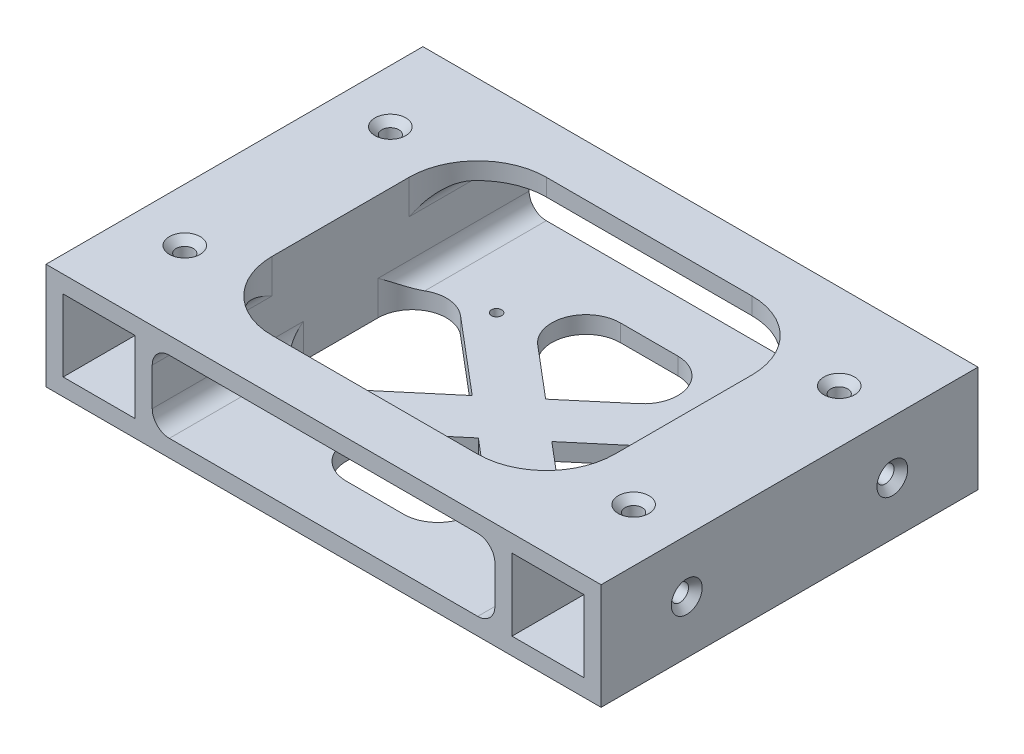
from build123d import *

# Parameters (mm, degrees)
SKETCH1_W           = 162
SKETCH1_H           = 31
SKETCH1_W_2         = 21
SKETCH1_H_2         = 21
SKETCH1_W_3         = 100
BOSS_EXTRUDE1_DEPTH = 55
SKETCH2_R           = 1.5
CUT_EXTRUDE1_DEPTH  = 5
SKETCH3_W           = 100
SKETCH3_H           = 80
CUT_EXTRUDE2_DEPTH  = 5
FILLET1_R           = 10
FILLET3_R           = 5
SKETCH4_R           = 2.5
CUT_EXTRUDE3_DEPTH  = 103.698588195
SKETCH5_R           = 2.5
CUT_EXTRUDE4_DEPTH  = 10
CHAMFER1_SIZE       = 2
FILLET4_START       = -40
FILLET4_DEPTH       = 20.0000001
FILLET4_START_2     = 19.9999999
FILLET4_2_DEPTH     = 20.0000001
FILLET4_START_3     = 4
FILLET4_3_DEPTH     = 11.5


with BuildPart() as part:
    # Sketch1 → Boss-Extrude1 (new, symmetric)
    with BuildSketch(Plane.XY):
        Rectangle(SKETCH1_W, SKETCH1_H)
        with Locations((65.5, 0)):
            Rectangle(SKETCH1_W_2, SKETCH1_H_2, mode=Mode.SUBTRACT)
        with Locations((-65.5, 0)):
            Rectangle(SKETCH1_W_2, SKETCH1_H_2, mode=Mode.SUBTRACT)
        Rectangle(SKETCH1_W_3, SKETCH1_H_2, mode=Mode.SUBTRACT)
    extrude(amount=BOSS_EXTRUDE1_DEPTH, both=True)

    # Sketch2 → Cut-Extrude1 (cut)
    with BuildSketch(Plane.XZ.offset(15.5)):
        with Locations(Location((29, -24.5, 0), (0, 0, 270))):
            Circle(SKETCH2_R)
        with Locations(Location((-29, -24.5, 0), (0, 0, 270))):
            Circle(SKETCH2_R)
        with Locations(Location((29, 24.5, 0), (0, 0, 270))):
            Circle(SKETCH2_R)
        with Locations(Location((-29, 24.5, 0), (0, 0, 270))):
            Circle(SKETCH2_R)
        Polygon((-50, -32.423155549), (-50, 32.423155549), (-11.621570983, 0), align=None)
        Polygon((-35.725367792, 40), (0, 9.818223762), (35.725367792, 40), align=None)
        Polygon((50, 32.423155549), (11.621570983, 0), (50, -32.423155549), align=None)
        Polygon((-35.725367792, -40), (0, -9.818223762), (35.725367792, -40), align=None)
    extrude(amount=-CUT_EXTRUDE1_DEPTH, mode=Mode.SUBTRACT)

    # Sketch3 → Cut-Extrude2 (cut)
    with BuildSketch(Plane(origin=(0, 15.5, 0), x_dir=(1, 0, 0), z_dir=(0, 1, 0))):
        Rectangle(SKETCH3_W, SKETCH3_H)
    extrude(amount=-CUT_EXTRUDE2_DEPTH, mode=Mode.SUBTRACT)

    # Fillet1
    fillet1_edges = [part.edges().sort_by_distance(p)[0] for p in [
        (-35.725367792, -13, -40),
        (35.725367792, -13, -40),
        (35.725367792, -13, 40),
        (-35.725367792, -13, 40),
        (50, -13, -32.423155549),
        (50, -13, 32.423155549),
        (-50, -13, 32.423155549),
        (-50, -13, -32.423155549),
    ]]
    fillet(fillet1_edges, radius=FILLET1_R)

    # Fillet3
    fillet3_edges = [part.edges().sort_by_distance(p)[0] for p in [
        (50, 10.5, -47.5),
        (-50, 10.5, -47.5),
        (-50, 10.5, 47.5),
        (-50, -10.5, 32.941957335),
        (50, -10.5, 32.941957335),
        (50, 10.5, 47.5),
        (50, -10.5, -32.941957335),
        (-50, -10.5, -32.941957335),
    ]]
    fillet(fillet3_edges, radius=FILLET3_R)

    # Sketch4 → Cut-Extrude3 (cut, through all)
    with BuildSketch(Plane(origin=(0, 15.5, 0), x_dir=(1, 0, 0), z_dir=(0, 1, 0))):
        with Locations(Location((65.5, 30, 0), (0, 0, 270))):
            Circle(SKETCH4_R)
        with Locations(Location((65.5, -30, 0), (0, 0, 270))):
            Circle(SKETCH4_R)
        with Locations(Location((-65.5, 30, 0), (0, 0, 270))):
            Circle(SKETCH4_R)
        with Locations(Location((-65.5, -30, 0), (0, 0, 270))):
            Circle(SKETCH4_R)
    extrude(amount=-CUT_EXTRUDE3_DEPTH, mode=Mode.SUBTRACT)

    # Sketch5 → Cut-Extrude4 (cut)
    with BuildSketch(Plane.ZY.offset(81)):
        with Locations((30, 0)):
            Circle(SKETCH5_R)
        with Locations((-30, 0)):
            Circle(SKETCH5_R)
    cut_extrude4 = extrude(amount=-CUT_EXTRUDE4_DEPTH, mode=Mode.SUBTRACT)

    # Mirror1: Cut-Extrude4 across plane
    add(cut_extrude4.mirror(Plane(origin=(0, 0, 0), x_dir=(0, 0, 1), z_dir=(1, 0, 0))), mode=Mode.SUBTRACT)

    # Chamfer1
    chamfer1_edges = [part.edges().sort_by_distance(p)[0] for p in [
        (65.5, -15.5, 27.5),
        (65.5, 15.5, 27.5),
        (-65.5, -15.5, -32.5),
        (-65.5, 15.5, -32.5),
        (-65.5, -15.5, 27.5),
        (-65.5, 15.5, 27.5),
        (65.5, -15.5, -32.5),
        (65.5, 15.5, -32.5),
        (-81, 0, 27.5),
        (-81, 0, -32.5),
        (81, 0, 27.5),
        (81, 0, -32.5),
    ]]
    chamfer(chamfer1_edges, length=CHAMFER1_SIZE)

    # Fillet4: read off the stored shape, not the designer's step
    # Fillet4 outline → Fillet4 (add)
    with BuildSketch(Plane.XY.offset(FILLET4_START)):
        with BuildLine():
            ThreePointArc((-50, 5.5), (-48.535533906, 9.035533906), (-45, 10.5))
            Line((-45, 10.5), (45, 10.5))
            ThreePointArc((45, 10.5), (48.535533906, 9.035533906), (50, 5.5))
            Line((50, 5.5), (50, 15.5))
            Line((50, 15.5), (-50, 15.5))
            Line((-50, 15.5), (-50, 5.5))
        make_face()
    extrude(amount=FILLET4_DEPTH)

    # Fillet4 2 outline → Fillet4 2 (add)
    with BuildSketch(Plane.XY.offset(FILLET4_START_2)):
        with BuildLine():
            ThreePointArc((-50, 5.5), (-48.535533906, 9.035533906), (-45, 10.5))
            Line((-45, 10.5), (45, 10.5))
            ThreePointArc((45, 10.5), (48.535533906, 9.035533906), (50, 5.5))
            Line((50, 5.5), (50, 15.5))
            Line((50, 15.5), (-50, 15.5))
            Line((-50, 15.5), (-50, 5.5))
        make_face()
    extrude(amount=FILLET4_2_DEPTH)

    # Fillet4 3 outline → Fillet4 3 (cut)
    with BuildSketch(Plane(origin=(0, 0, 0), x_dir=(1, 0, 0), z_dir=(0, 1, 0)).offset(FILLET4_START_3)):
        with BuildLine():
            ThreePointArc((-50, -20), (-44.142135624, -34.142135624), (-30, -40))
            Line((-30, -40), (30, -40))
            ThreePointArc((30, -40), (44.142135624, -34.142135624), (50, -20))
            Line((50, -20), (-50, -20))
        make_face()
        with BuildLine():
            ThreePointArc((50, 20), (44.142135624, 34.142135624), (30, 40))
            Line((30, 40), (-30, 40))
            ThreePointArc((-30, 40), (-44.142135624, 34.142135624), (-50, 20))
            Line((-50, 20), (50, 20))
        make_face()
    extrude(amount=FILLET4_3_DEPTH, mode=Mode.SUBTRACT)


solid = part.part
